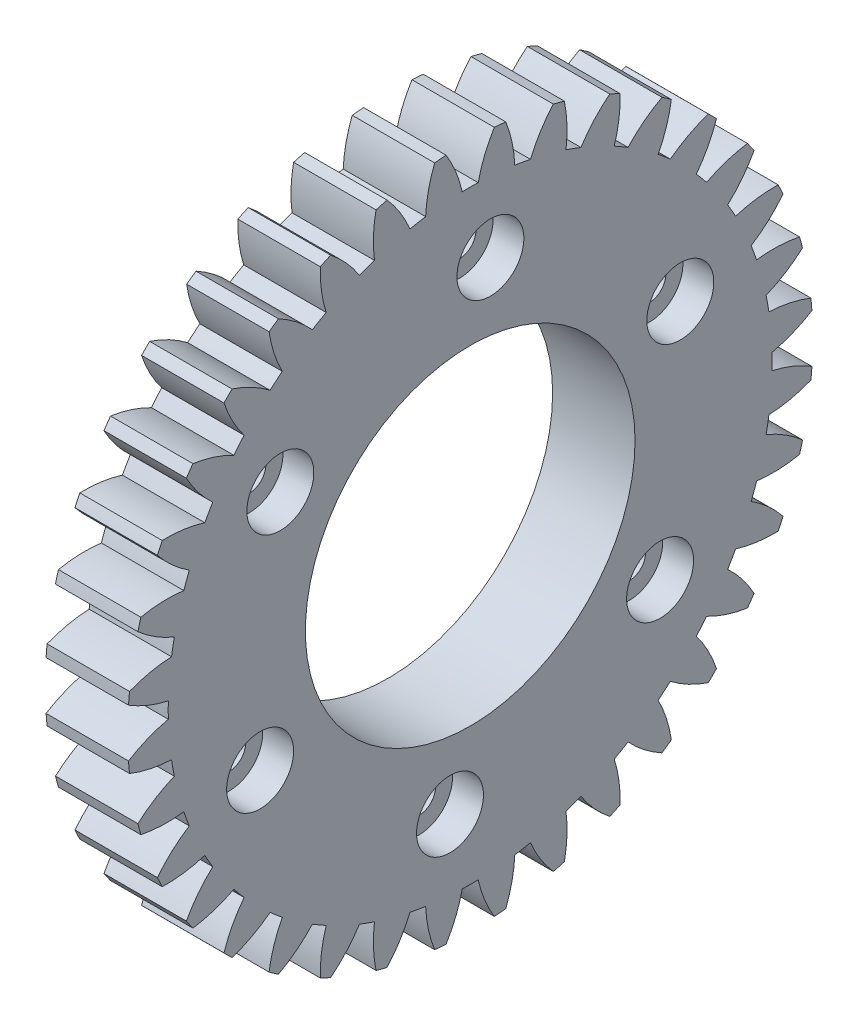
from build123d import *

# Parameters (mm, degrees)
BASPROSKE_W                  = 8
BASPROSKE_H                  = 33.25
TOOTHCUT_DEPTH               = 48.698270409
TEETHCUTS_COUNT              = 36
TEETHCUTS_ANGLE              = 350
BORSKE_R                     = 4
BORE_DEPTH                   = 50.0000508
ESQUISSE1_R                  = 16
ENL_V_MAT_EXTRU_1_DEPTH      = 10
ESQUISSE2_R                  = 1.6
ENL_V_MAT_EXTRU_2_DEPTH      = 10
ESQUISSE3_R                  = 3.25
ENL_V_MAT_EXTRU_3_DEPTH      = 3
R_P_TITION_CIRCULAIRE2_COUNT = 6


with BuildPart() as part:
    # BasProSke → Base-Revolve (revolve)
    with BuildSketch(Plane(origin=(0, 0, 0), x_dir=(1, 0, 0), z_dir=(0, 1, 0))):
        with Locations((4, 16.625)):
            Rectangle(BASPROSKE_W, BASPROSKE_H)
    revolve(axis=Axis((-10, 0, 0), (1, 0, 0)))

    # TooCutSke → ToothCut (cut, through all)
    with BuildSketch(Plane(origin=(0, 0, 0), x_dir=(0, 0, -1), z_dir=(1, 0, 0))):
        with BuildLine():
            ThreePointArc((0.773836769, 29.3012834), (0, 29.3115), (-0.773836769, 29.3012834))
            ThreePointArc((-0.773836769, 29.3012834), (-1.403294931, 31.313012095), (-2.359315682, 33.19165369))
            ThreePointArc((-2.359315682, 33.19165369), (0, 33.2754), (2.359315682, 33.19165369))
            ThreePointArc((2.359315682, 33.19165369), (1.403294931, 31.313012095), (0.773836769, 29.3012834))
        make_face()
    toothcut = extrude(amount=TOOTHCUT_DEPTH, mode=Mode.SUBTRACT)

    # TeethCuts: ToothCut ×36 about axis
    teethcuts_axis = Axis((-10, 0, 0), (1, 0, 0))
    for i in range(1, TEETHCUTS_COUNT):
        add(toothcut.rotate(teethcuts_axis, i * TEETHCUTS_ANGLE / (TEETHCUTS_COUNT - 1)), mode=Mode.SUBTRACT)

    # BorSke → Bore (cut, symmetric)
    with BuildSketch(Plane(origin=(0, 0, 0), x_dir=(0, 0, -1), z_dir=(1, 0, 0))):
        Circle(BORSKE_R)
    extrude(amount=BORE_DEPTH, both=True, mode=Mode.SUBTRACT)

    # Esquisse1 → Enlèv. mat.-Extru.1 (cut)
    with BuildSketch(Plane(origin=(8, 0, 0), x_dir=(0, 0, -1), z_dir=(1, 0, 0))):
        Circle(ESQUISSE1_R)
    extrude(amount=-ENL_V_MAT_EXTRU_1_DEPTH, mode=Mode.SUBTRACT)

    # Esquisse2 → Enlèv. mat.-Extru.2 (cut)
    with BuildSketch(Plane(origin=(8, 0, 0), x_dir=(0, 0, -1), z_dir=(1, 0, 0))):
        with Locations((1.961004212, 22.414380707)):
            Circle(ESQUISSE2_R)
    enl_v_mat_extru_2 = extrude(amount=-ENL_V_MAT_EXTRU_2_DEPTH, mode=Mode.SUBTRACT)

    # Esquisse3 → Enlèv. mat.-Extru.3 (cut)
    with BuildSketch(Plane(origin=(8, 0, 0), x_dir=(0, 0, -1), z_dir=(1, 0, 0))):
        with Locations((1.961004212, 22.414380707)):
            Circle(ESQUISSE3_R)
    enl_v_mat_extru_3 = extrude(amount=-ENL_V_MAT_EXTRU_3_DEPTH, mode=Mode.SUBTRACT)

    # Répétition circulaire2: Enlèv. mat.-Extru.2, Enlèv. mat.-Extru.3 ×6 about axis
    r_p_tition_circulaire2_axis = Axis((8, 0, 0), (1, 0, 0))
    add([enl_v_mat_extru_2.rotate(r_p_tition_circulaire2_axis, i * 360 / R_P_TITION_CIRCULAIRE2_COUNT) for i in range(1, R_P_TITION_CIRCULAIRE2_COUNT)], mode=Mode.SUBTRACT)
    add([enl_v_mat_extru_3.rotate(r_p_tition_circulaire2_axis, i * 360 / R_P_TITION_CIRCULAIRE2_COUNT) for i in range(1, R_P_TITION_CIRCULAIRE2_COUNT)], mode=Mode.SUBTRACT)


solid = part.part
